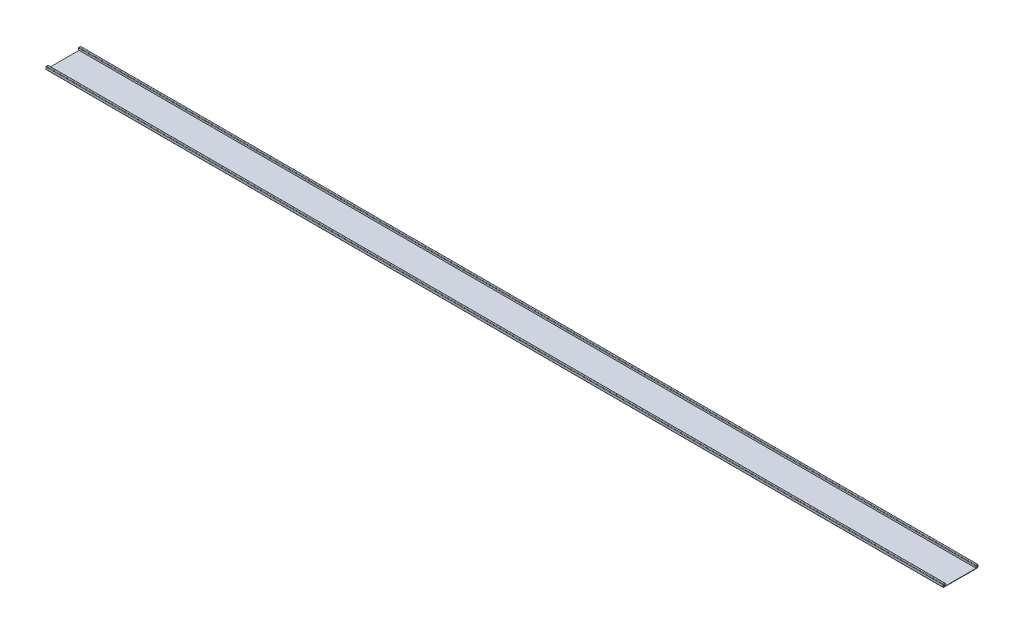
from build123d import *

# Parameters (mm, degrees)
BASE_FLANGE1_DEPTH = 6000


# Sheet-metal steps are written as plain solids
with BuildPart() as part:
    # Sketch2 → Base-Flange1 (new body)
    with BuildSketch(Plane(origin=(4600, 0, 0), x_dir=(0, 0, -1), z_dir=(1, 0, 0))):
        with BuildLine():
            Line((-161.25, -79.66), (-161.25, -67.8966))
            ThreePointArc((-161.25, -67.8966), (-162.197978192, -65.607978192), (-164.4866, -64.66))
            Line((-164.4866, -64.66), (-173.0134, -64.66))
            ThreePointArc((-173.0134, -64.66), (-175.302021808, -65.607978192), (-176.25, -67.8966))
            Line((-176.25, -67.8966), (-176.25, -81.4234))
            ThreePointArc((-176.25, -81.4234), (-175.302021808, -83.712021808), (-173.0134, -84.66))
            Line((-173.0134, -84.66), (53.9234, -84.66))
            ThreePointArc((53.9234, -84.66), (56.212021808, -83.712021808), (57.16, -81.4234))
            Line((57.16, -81.4234), (57.16, -67.8966))
            ThreePointArc((57.16, -67.8966), (56.212021808, -65.607978192), (53.9234, -64.66))
            Line((53.9234, -64.66), (45.3966, -64.66))
            ThreePointArc((45.3966, -64.66), (43.107978192, -65.607978192), (42.16, -67.8966))
            Line((42.16, -67.8966), (42.16, -79.66))
            Line((42.16, -79.66), (44.66, -79.66))
            Line((44.66, -79.66), (44.66, -67.8966))
            ThreePointArc((44.66, -67.8966), (44.875745145, -67.375745145), (45.3966, -67.16))
            Line((45.3966, -67.16), (53.9234, -67.16))
            ThreePointArc((53.9234, -67.16), (54.444254855, -67.375745145), (54.66, -67.8966))
            Line((54.66, -67.8966), (54.66, -81.4234))
            ThreePointArc((54.66, -81.4234), (54.444254855, -81.944254855), (53.9234, -82.16))
            Line((53.9234, -82.16), (-173.0134, -82.16))
            ThreePointArc((-173.0134, -82.16), (-173.534254855, -81.944254855), (-173.75, -81.4234))
            Line((-173.75, -81.4234), (-173.75, -67.8966))
            ThreePointArc((-173.75, -67.8966), (-173.534254855, -67.375745145), (-173.0134, -67.16))
            Line((-173.0134, -67.16), (-164.4866, -67.16))
            ThreePointArc((-164.4866, -67.16), (-163.965745145, -67.375745145), (-163.75, -67.8966))
            Line((-163.75, -67.8966), (-163.75, -79.66))
            Line((-163.75, -79.66), (-161.25, -79.66))
        make_face()
    extrude(amount=-BASE_FLANGE1_DEPTH)


solid = part.part
